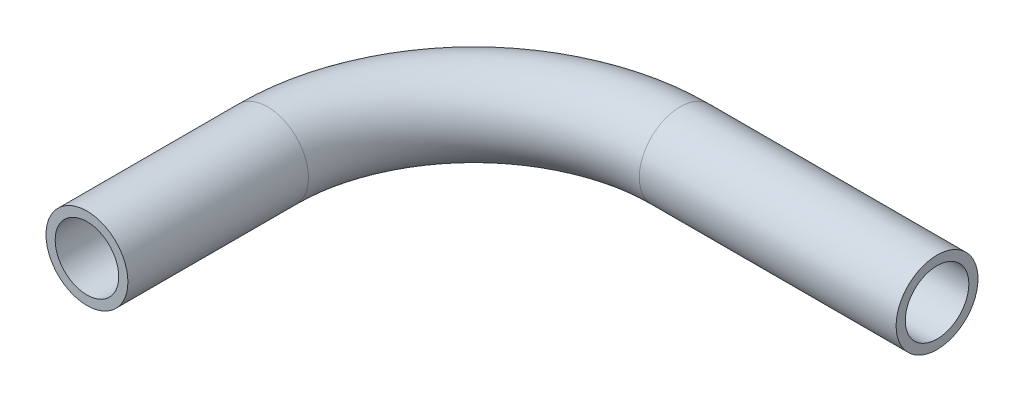
from build123d import *

# Parameters (mm, degrees)
SKETCH2_R   = 3.175
SKETCH2_R_2 = 2.4638


with BuildPart() as part:
    # Sweep-Thin1: sweep along a path in Sketch1
    with BuildLine(Plane(origin=(0, 0, 0), x_dir=(1, 0, 0), z_dir=(0, 1, 0))) as sweep_thin1_path:
        Line((0, 0), (0, 14))
        ThreePointArc((0, 14), (4.686291501, 25.313708499), (16, 30))
        Line((16, 30), (16.565397447, 30))
        Line((16.565397447, 30), (35.9156, 30))
    # Sketch2 → Sweep-Thin1 (sweep)
    with BuildSketch(Plane.XY):
        Circle(SKETCH2_R)
        Circle(SKETCH2_R_2, mode=Mode.SUBTRACT)
    sweep(path=sweep_thin1_path.line)


solid = part.part
